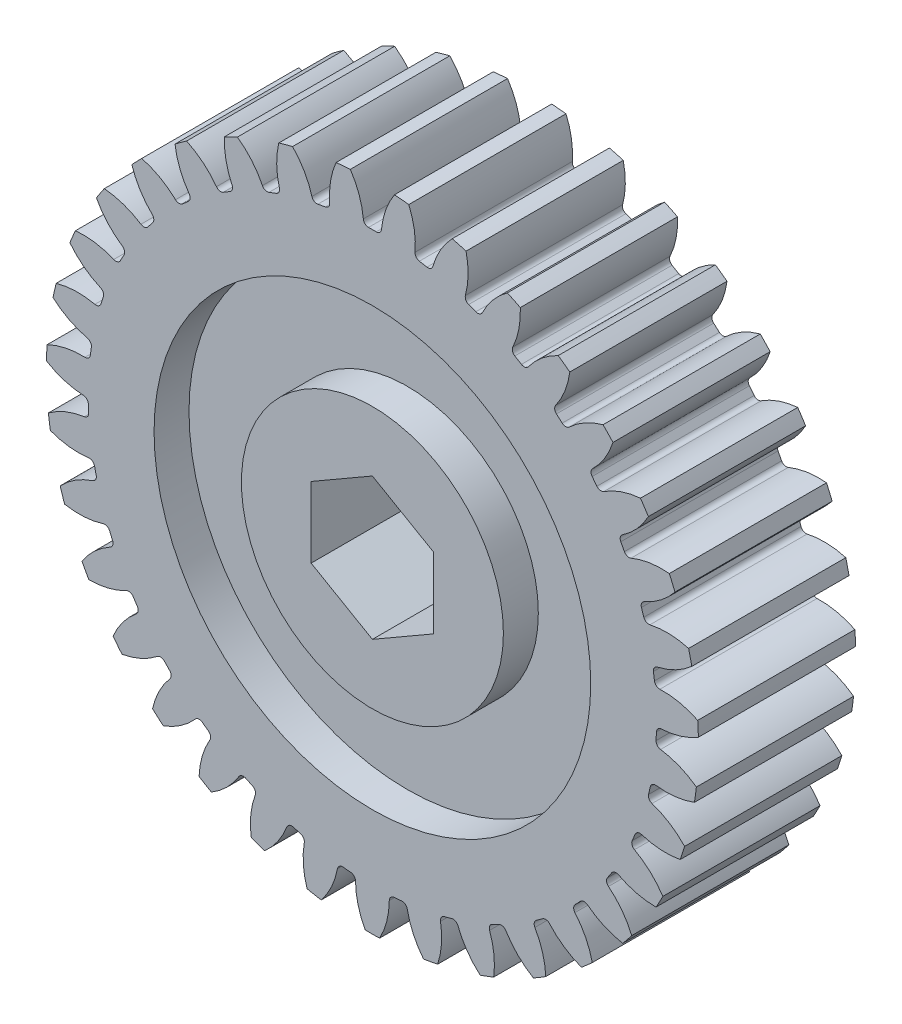
from build123d import *

# Parameters (mm, degrees)
SKIZZE1_R                       = 18.6665
AUFSATZ_LINEAR_AUSTRAGEN1_DEPTH = 4.5
SKIZZE4_R                       = 12.5
SKIZZE4_R_2                     = 7.5
SCHNITT_LINEAR_AUSTRAGEN2_DEPTH = 2
SCHNITT_LINEAR_AUSTRAGEN3_DEPTH = 28.890436434
KREISMUSTER1_COUNT              = 35
SKIZZE8_R                       = 6
AUFSATZ_LINEAR_AUSTRAGEN2_DEPTH = 1
SCHNITT_LINEAR_AUSTRAGEN4_DEPTH = 29.225773279


with BuildPart() as part:
    # Skizze1 → Aufsatz-Linear austragen1 (new, symmetric)
    with BuildSketch(Plane.XY):
        Circle(SKIZZE1_R)
    extrude(amount=AUFSATZ_LINEAR_AUSTRAGEN1_DEPTH, both=True)

    # Skizze4 → Schnitt-Linear austragen2 (cut)
    with BuildSketch(Plane.XY.offset(4.5)):
        Circle(SKIZZE4_R)
        Circle(SKIZZE4_R_2, mode=Mode.SUBTRACT)
    extrude(amount=-SCHNITT_LINEAR_AUSTRAGEN2_DEPTH, mode=Mode.SUBTRACT)

    # Skizze6 → Schnitt-Linear austragen3 (cut, through all)
    with BuildSketch(Plane.XY.offset(4.5)):
        with BuildLine():
            Line((-0.219874756, 16.267), (0.219874756, 16.267))
            ThreePointArc((0.219874756, 16.267), (0.421386888, 16.344754953), (0.518441911, 16.537714262))
            ThreePointArc((0.518441911, 16.537714262), (1.009154991, 18.192876188), (2.08, 19.547))
            ThreePointArc((2.08, 19.547), (0, 19.667581665), (-2.08, 19.547))
            ThreePointArc((-2.08, 19.547), (-1.009154991, 18.192876188), (-0.518441911, 16.537714262))
            ThreePointArc((-0.518441911, 16.537714262), (-0.421386888, 16.344754953), (-0.219874756, 16.267))
        make_face()
    schnitt_linear_austragen3 = extrude(amount=-SCHNITT_LINEAR_AUSTRAGEN3_DEPTH, mode=Mode.SUBTRACT)

    # Kreismuster1: Schnitt-Linear austragen3 ×35 about axis
    kreismuster1_axis = Axis((0, 0, 2.5), (0, 0, 1))
    for i in range(1, KREISMUSTER1_COUNT):
        add(schnitt_linear_austragen3.rotate(kreismuster1_axis, i * 360 / KREISMUSTER1_COUNT), mode=Mode.SUBTRACT)

    # Skizze8 → Aufsatz-Linear austragen2 (add)
    with BuildSketch(Plane(origin=(0, 0, -4.5), x_dir=(-1, 0, 0), z_dir=(0, 0, -1))):
        Circle(SKIZZE8_R)
    extrude(amount=AUFSATZ_LINEAR_AUSTRAGEN2_DEPTH)

    # Skizze7 → Schnitt-Linear austragen4 (cut, through all)
    with BuildSketch(Plane.XY.offset(4.5)):
        Polygon((0, 4.05), (-3.507402885, 2.025), (-3.507402885, -2.025), (0, -4.05), (3.507402885, -2.025), (3.507402885, 2.025), align=None)
    extrude(amount=-SCHNITT_LINEAR_AUSTRAGEN4_DEPTH, mode=Mode.SUBTRACT)


solid = part.part
